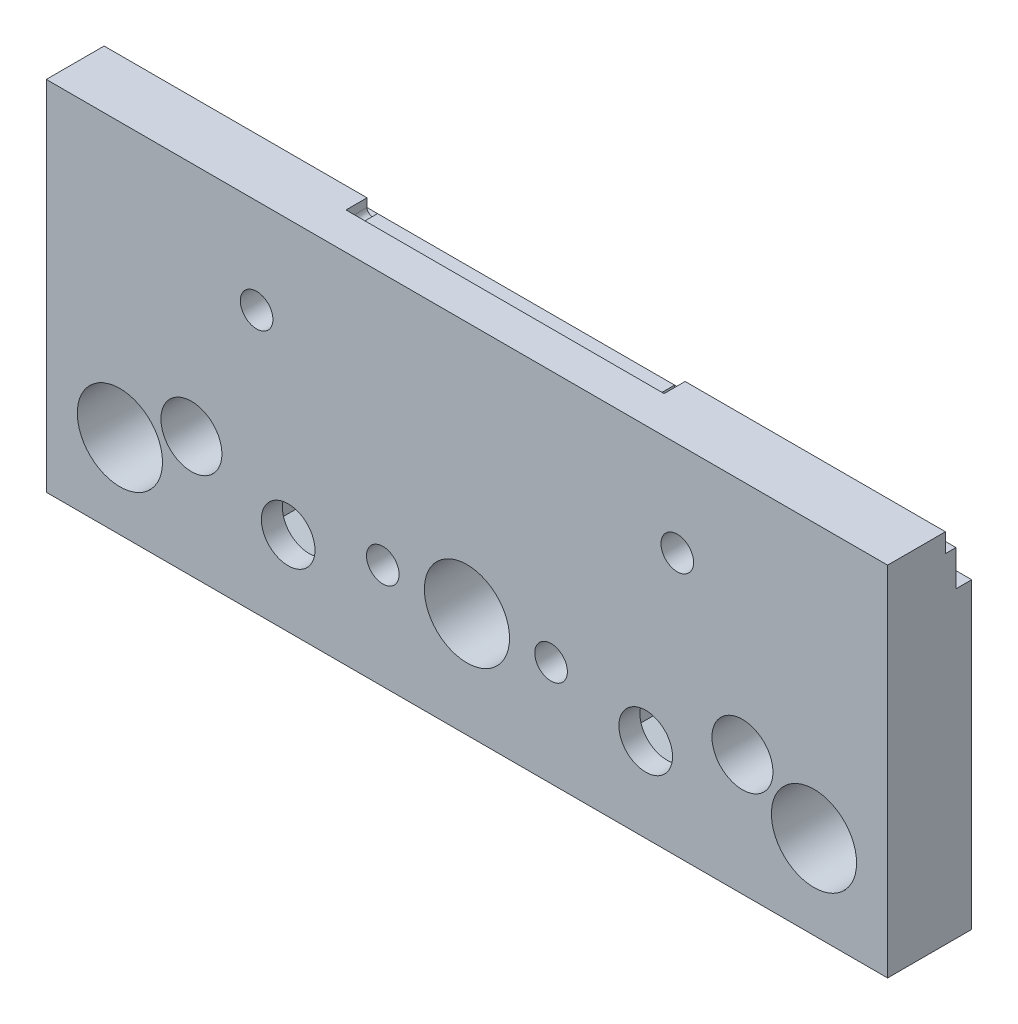
from build123d import *

# Parameters (mm, degrees)
SKETCH_2_W           = 80
SKETCH_2_H           = 34
SKETCH_2_R           = 4.05
EXTRUDE_1_DEPTH      = 8
SKETCH_3_R           = 2.55
CUT_EXTRUDE_1_DEPTH  = 88.292611371
CUT_EXTRUDE_2_DEPTH  = 88.292611371
SKETCH_5_R           = 1.55
CUT_EXTRUDE_3_DEPTH  = 88.292611371
CUT_EXTRUDE_15_DEPTH = 4.5
SKETCH_11_R          = 1.55
CUT_EXTRUDE_7_DEPTH  = 88.292611371
CUT_EXTRUDE_11_DEPTH = 2
SKETCH_21_R          = 2.9
CUT_EXTRUDE_13_DEPTH = 88.292611371
CUT_EXTRUDE_14_DEPTH = 6


with BuildPart() as part:
    # 草图2 → 凸台-拉伸1 (new body)
    with BuildSketch(Plane.XY):
        with Locations((40, 17)):
            Rectangle(SKETCH_2_W, SKETCH_2_H)
        with Locations((7, 8)):
            Circle(SKETCH_2_R, mode=Mode.SUBTRACT)
        with Locations((40, 10)):
            Circle(SKETCH_2_R, mode=Mode.SUBTRACT)
        with Locations((73, 8)):
            Circle(SKETCH_2_R, mode=Mode.SUBTRACT)
    extrude(amount=EXTRUDE_1_DEPTH)

    # 草图3 → 切除-拉伸1 (cut, through all)
    with BuildSketch(Plane.XY.offset(8)):
        with Locations((23, 8)):
            Circle(SKETCH_3_R)
        with Locations((57, 8)):
            Circle(SKETCH_3_R)
    extrude(amount=-CUT_EXTRUDE_1_DEPTH, mode=Mode.SUBTRACT)

    # 草图4 → 切除-拉伸2 (cut, through all)
    with BuildSketch(Plane(origin=(80, 0, 0), x_dir=(0, 0, -1), z_dir=(1, 0, 0))):
        Polygon((-1.5, 32.2), (-2.5, 32.2), (-2.5, 34), (0, 34), (0, 28.8), (-1.5, 28.8), align=None)
    extrude(amount=-CUT_EXTRUDE_2_DEPTH, mode=Mode.SUBTRACT)

    # 草图5 → 切除-拉伸3 (cut, through all)
    with BuildSketch(Plane.XY.offset(8)):
        with Locations((48, 10)):
            Circle(SKETCH_5_R)
        with Locations((32, 10)):
            Circle(SKETCH_5_R)
    extrude(amount=-CUT_EXTRUDE_3_DEPTH, mode=Mode.SUBTRACT)

    # 草图8 → 切除-拉伸15 (cut)
    with BuildSketch(Plane(origin=(0, 0, 0), x_dir=(-1, 0, 0), z_dir=(0, 0, -1))):
        Polygon((-48, 6.709103466), (-45.15, 8.354551733), (-45.15, 11.645448267), (-48, 13.290896534), (-50.85, 11.645448267), (-50.85, 8.354551733), align=None)
        Polygon((-34.85, 11.645448267), (-34.85, 8.354551733), (-32, 6.709103466), (-29.15, 8.354551733), (-29.15, 11.645448267), (-32, 13.290896534), align=None)
    extrude(amount=-CUT_EXTRUDE_15_DEPTH, mode=Mode.SUBTRACT)

    # 草图11 → 切除-拉伸7 (cut, through all)
    with BuildSketch(Plane(origin=(0, 0, 0), x_dir=(-1, 0, 0), z_dir=(0, 0, -1))):
        with Locations((-60, 25)):
            Circle(SKETCH_11_R)
        with Locations((-20, 25)):
            Circle(SKETCH_11_R)
    extrude(amount=-CUT_EXTRUDE_7_DEPTH, mode=Mode.SUBTRACT)

    # 草图19 → 切除-拉伸11 (cut)
    with BuildSketch(Plane(origin=(0, 0, 2.5), x_dir=(-1, 0, 0), z_dir=(0, 0, -1))):
        with BuildLine():
            Line((-25, 34), (-55.247938178, 34))
            Line((-55.247938178, 34), (-55.247938178, 33.2))
            ThreePointArc((-55.247938178, 33.2), (-54.747938178, 32.7), (-54.247938178, 33.2))
            Line((-54.247938178, 33.2), (-26, 33.2))
            ThreePointArc((-26, 33.2), (-25.5, 32.7), (-25, 33.2))
            Line((-25, 33.2), (-25, 34))
        make_face()
    extrude(amount=-CUT_EXTRUDE_11_DEPTH, mode=Mode.SUBTRACT)

    # 草图21 → 切除-拉伸13 (cut, through all)
    with BuildSketch(Plane(origin=(0, 0, 0), x_dir=(-1, 0, 0), z_dir=(0, 0, -1))):
        with Locations((-66.2, 11.5)):
            Circle(SKETCH_21_R)
        with Locations((-13.8, 11.5)):
            Circle(SKETCH_21_R)
    extrude(amount=-CUT_EXTRUDE_13_DEPTH, mode=Mode.SUBTRACT)

    # 草图22 → 切除-拉伸14 (cut)
    with BuildSketch(Plane(origin=(0, 0, 0), x_dir=(-1, 0, 0), z_dir=(0, 0, -1))):
        Polygon((-52.9, 5.632863896), (-52.9, 10.367136104), (-57, 12.734272207), (-61.1, 10.367136104), (-61.1, 5.632863896), (-57, 3.265727793), align=None)
        Polygon((-23, 3.265727793), (-18.9, 5.632863896), (-18.9, 10.367136104), (-23, 12.734272207), (-27.1, 10.367136104), (-27.1, 5.632863896), align=None)
    extrude(amount=-CUT_EXTRUDE_14_DEPTH, mode=Mode.SUBTRACT)


solid = part.part
